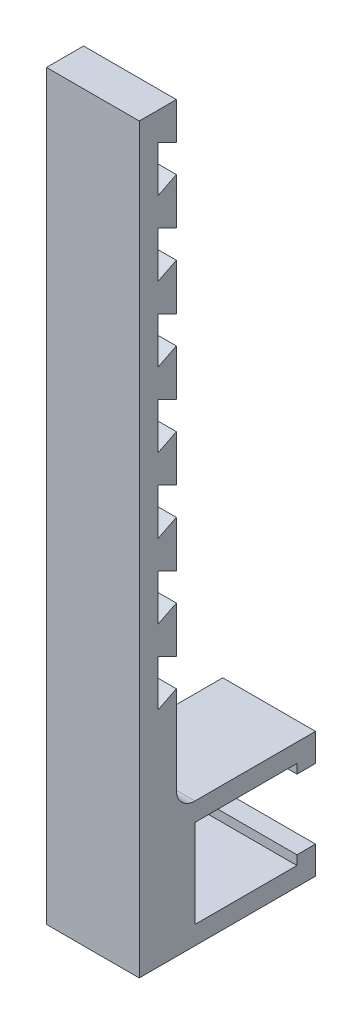
from build123d import *

# Parameters (mm, degrees)
MAINBODY_DEPTH      = 5
SKETCH5_W           = 10
SKETCH5_H           = 80
HEIGHTSUPPORT_DEPTH = 4
FILLET2_R           = 2
SLOT_DEPTH          = 74.485728893
LPATTERN1_COUNT     = 7
LPATTERN1_PITCH     = 8


with BuildPart() as part:
    # Sketch1 → MainBody (new, symmetric)
    with BuildSketch(Plane(origin=(0, 0, 0), x_dir=(0, 0, -1), z_dir=(1, 0, 0))):
        Polygon((11.432780448, 5.42384479), (-3.567219552, 5.42384479), (-3.567219552, -8.101155209), (11.432780448, -8.101155209), (11.432780448, -5.101155209), (9.432780448, -5.101155209), (9.432780448, -6.101155209), (-1.567219552, -6.101155209), (-1.567219552, 3.42384479), (9.432780448, 3.42384479), (9.432780448, 2.42384479), (11.432780448, 2.42384479), align=None)
    extrude(amount=MAINBODY_DEPTH, both=True)

    # Sketch5 → HeightSupport (add)
    with BuildSketch(Plane.XY.offset(3.567219552)):
        with Locations((0, 31.898844791)):
            Rectangle(SKETCH5_W, SKETCH5_H)
    extrude(amount=HEIGHTSUPPORT_DEPTH)

    # Fillet2
    fillet2_edges = [part.edges().sort_by_distance(p)[0] for p in [
        (0, 5.42384479, 3.567219552),
    ]]
    fillet(fillet2_edges, radius=FILLET2_R)

    # Sketch7 → Slot (cut, through all)
    with BuildSketch(Plane.ZY.offset(5)):
        Polygon((3.567219552, 67.898844791), (3.567219552, 64.898844791), (5.567219552, 63.898844791), (5.567219552, 68.898844791), align=None)
    slot = extrude(amount=-SLOT_DEPTH, mode=Mode.SUBTRACT)

    # LPattern1: Slot ×7
    with Locations(*[(0, -i * LPATTERN1_PITCH, 0) for i in range(1, LPATTERN1_COUNT)]):
        add(slot, mode=Mode.SUBTRACT)


solid = part.part
